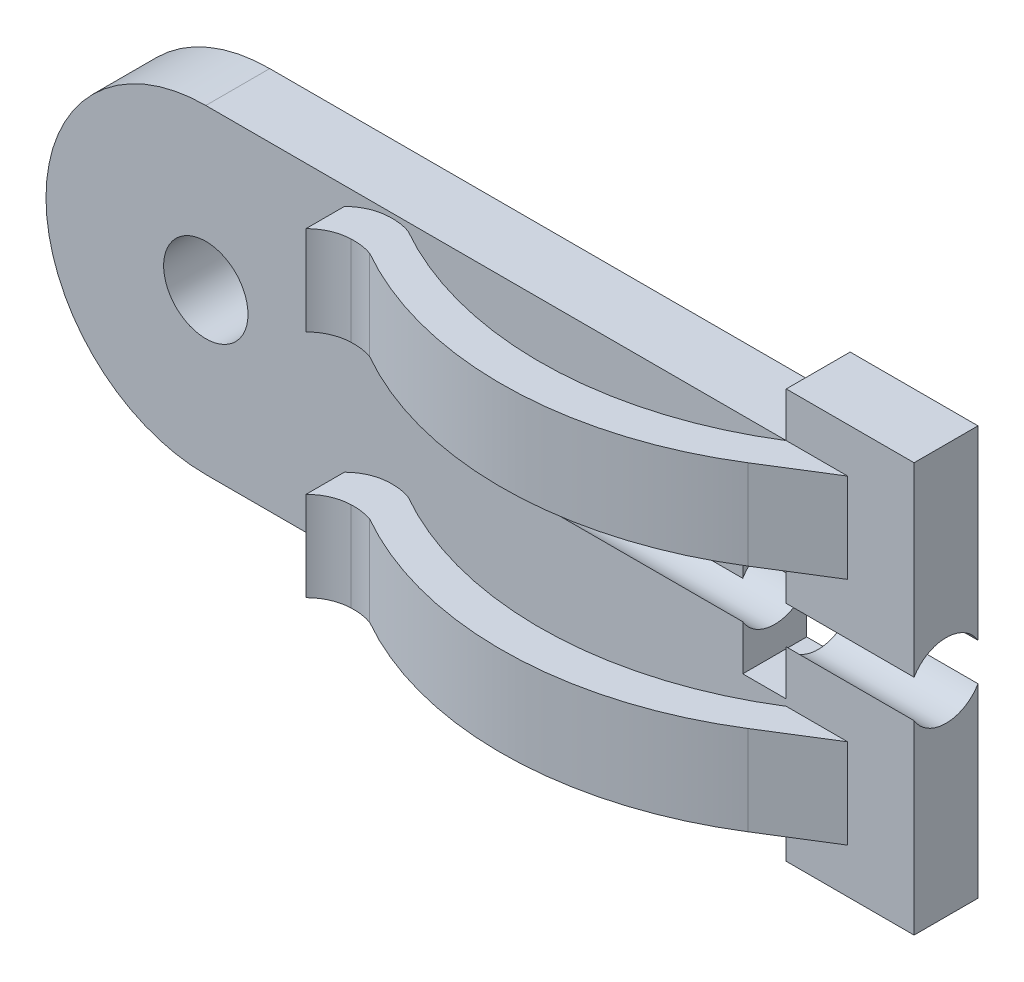
from build123d import *

# Parameters (mm, degrees)
SKETCH1_R           = 1.65
BOSS_EXTRUDE1_DEPTH = 2.5
SKETCH2_W           = 5
SKETCH2_H           = 16
BOSS_EXTRUDE2_DEPTH = 2.5
SKETCH3_W           = 1.7
SKETCH3_H           = 5
CUT_EXTRUDE1_DEPTH  = 29.940283343
SKETCH6_R           = 1.45
CUT_EXTRUDE3_DEPTH  = 16.7
BOSS_EXTRUDE3_DEPTH = 3.5
BOSS_EXTRUDE5_DEPTH = 3.5


with BuildPart() as part:
    # Sketch1 → Boss-Extrude1 (new body)
    with BuildSketch(Plane.XY):
        with BuildLine():
            ThreePointArc((0, 6.25), (-6.25, 0), (0, -6.25))
            Line((0, -6.25), (22.7, -6.25))
            Line((22.7, -6.25), (22.7, 6.25))
            Line((22.7, 6.25), (0, 6.25))
        make_face()
        Circle(SKETCH1_R, mode=Mode.SUBTRACT)
    extrude(amount=BOSS_EXTRUDE1_DEPTH)

    # Sketch2 → Boss-Extrude2 (add)
    with BuildSketch(Plane.XY.offset(2.5)):
        with Locations((25.2, 0)):
            Rectangle(SKETCH2_W, SKETCH2_H)
    extrude(amount=-BOSS_EXTRUDE2_DEPTH)

    # Sketch3 → Cut-Extrude1 (cut, through all)
    with BuildSketch(Plane.XY.offset(2.5)):
        with Locations((21.85, 0)):
            Rectangle(SKETCH3_W, SKETCH3_H)
    extrude(amount=-CUT_EXTRUDE1_DEPTH, mode=Mode.SUBTRACT)

    # Sketch6 → Cut-Extrude3 (cut)
    with BuildSketch(Plane(origin=(27.7, 0, 0), x_dir=(0, 0, -1), z_dir=(1, 0, 0))):
        with Locations((-1.25, 0)):
            Circle(SKETCH6_R)
    extrude(amount=-CUT_EXTRUDE3_DEPTH, mode=Mode.SUBTRACT)


with BuildPart() as body_2:
    # Sketch7 → Boss-Extrude3 (new body)
    with BuildSketch(Plane.XZ.offset(6.25)):
        with BuildLine():
            Line((6.129900512, 3.210673711), (6.129900512, 4.710673711))
            ThreePointArc((6.129900512, 4.710673711), (6.694341527, 4.327552018), (7.360579964, 4.180915603))
            ThreePointArc((7.360579964, 4.180915603), (7.789326283, 4.199870579), (8.206709695, 4.299739418))
            ThreePointArc((8.206709695, 4.299739418), (15.494742209, 6.151071465), (22.7, 4))
            Line((22.7, 4), (22.7, 2.5))
            ThreePointArc((22.7, 2.5), (15.494742209, 4.651071465), (8.206709695, 2.799739418))
            ThreePointArc((8.206709695, 2.799739418), (7.789326283, 2.699870579), (7.360579964, 2.680915603))
            ThreePointArc((7.360579964, 2.680915603), (6.694341527, 2.827552018), (6.129900512, 3.210673711))
        make_face()
    extrude(amount=-BOSS_EXTRUDE3_DEPTH)


with BuildPart() as body_3:
    # Sketch9 → Boss-Extrude5 (new body)
    with BuildSketch(Plane.XZ.offset(6.25)):
        Polygon((22.7, 4), (25.104907101, 2.5), (22.7, 2.5), align=None)
    extrude(amount=-BOSS_EXTRUDE5_DEPTH)

    # Combine1: union body 2
    add(body_2.part)


with BuildPart() as body_3_2:
    # Mirror4: mirrored copy
    add(body_3.part.mirror(Plane(origin=(0, 0, 2.5), x_dir=(0, 0, 1), z_dir=(0, 1, 0))))


solid = Compound([part.part, body_3.part, body_3_2.part])
